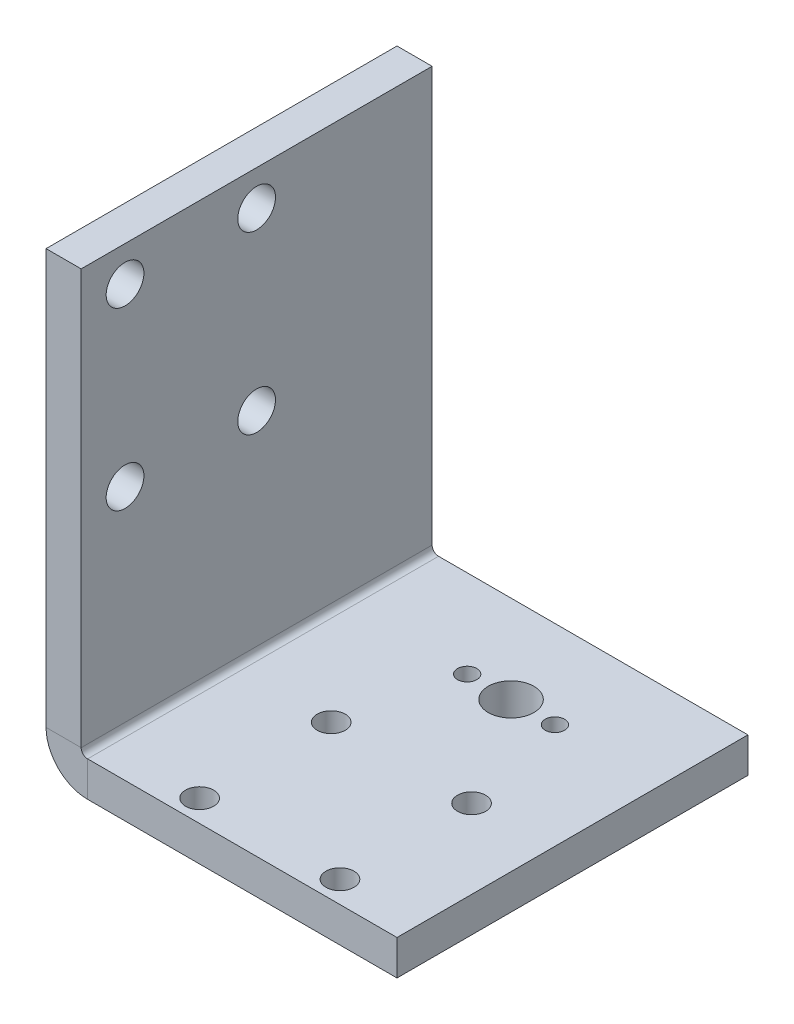
from build123d import *

# Parameters (mm, degrees)
SM_BASE_FLANGE_2_DEPTH = 20
HOLE_WIZARD_M3_1_D     = 3.2
SKETCH_24_R            = 2.6
CUT_EXTRUDE_2_DEPTH    = 67.332495807
HOLE_WIZARD_M4_1_D     = 4.3
HOLE_WIZARD_M2_1_D     = 2.2


# Sheet-metal steps are written as plain solids
with BuildPart() as part:
    # 草圖16 → 基材-凸緣2 (new, symmetric)
    with BuildSketch(Plane.XY):
        with BuildLine():
            Line((36, 0), (0.7366, 0))
            ThreePointArc((0.7366, 0), (0.215745145, 0.215745145), (0, 0.7366))
            Line((0, 0.7366), (0, 48))
            Line((0, 48), (-4, 48))
            Line((-4, 48), (-4, 0.7366))
            ThreePointArc((-4, 0.7366), (-2.61268198, -2.61268198), (0.7366, -4))
            Line((0.7366, -4), (36, -4))
            Line((36, -4), (36, 0))
        make_face()
    extrude(amount=SM_BASE_FLANGE_2_DEPTH, both=True)

    # M3 餘隙孔1 (through all)
    with Locations(Plane(origin=(0, 0, 0), x_dir=(-1, 0, 0), z_dir=(0, 1, 0))):
        with Locations((-27, 17.5), (-11, 2.5), (-11, 17.5), (-27, 2.5)):
            Hole(HOLE_WIZARD_M3_1_D / 2)

    # 草圖24 → 除料-伸長2 (cut, through all)
    with BuildSketch(Plane.XZ.offset(4)):
        with Locations(Location((19, -10, 0), (0, 0, 270))):
            Circle(SKETCH_24_R)
    extrude(amount=-CUT_EXTRUDE_2_DEPTH, mode=Mode.SUBTRACT)

    # M4 餘隙孔1 (through all)
    with Locations(Plane(origin=(0, 0, 0), x_dir=(0, 0, 1), z_dir=(1, 0, 0))):
        with Locations((0, -44), (15, -44), (15, -24), (0, -24)):
            Hole(HOLE_WIZARD_M4_1_D / 2)

    # M2 餘隙孔1 (through all)
    with Locations(Plane(origin=(0, -4, 0), x_dir=(-1, 0, 0), z_dir=(0, -1, 0))):
        with Locations((-14, 10), (-24, 10)):
            Hole(HOLE_WIZARD_M2_1_D / 2)


solid = part.part
